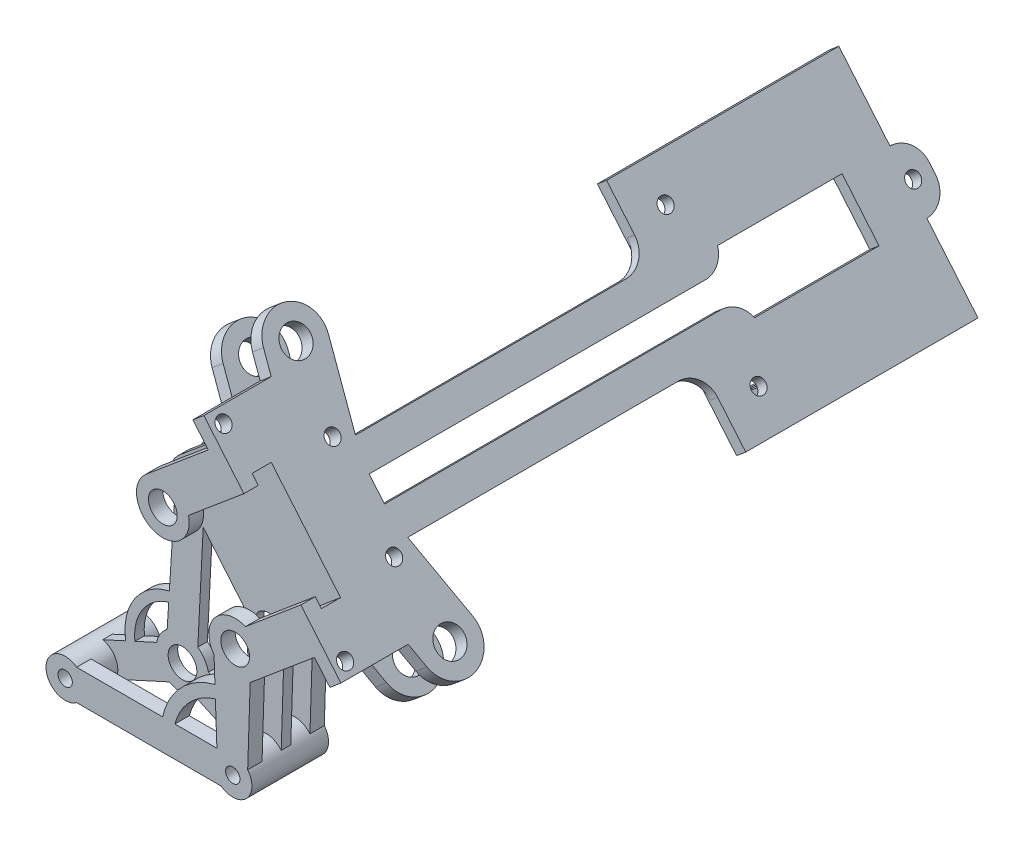
from build123d import *

# Parameters (mm, degrees)
SKETCH2_R             = 4
SKETCH2_R_2           = 1.5
BOSS_EXTRUDE1_DEPTH   = 7
BOSS_EXTRUDE1_2_DEPTH = 7
SKETCH3_R             = 1.5
SKETCH3_R_2           = 3
SKETCH3_R_3           = 4
BOSS_EXTRUDE2_DEPTH   = 2
SKETCH6_R             = 1.5
SKETCH6_R_2           = 3
SKETCH6_R_3           = 5.5
BOSS_EXTRUDE4_DEPTH   = 3
SKETCH7_R             = 4
SKETCH7_R_2           = 1.5
BOSS_EXTRUDE5_DEPTH   = 4
SKETCH8_R             = 3
BOSS_EXTRUDE6_DEPTH   = 3
SKETCH9_R             = 3
SKETCH9_R_2           = 1.5
BOSS_EXTRUDE8_DEPTH   = 3
BOSS_EXTRUDE9_DEPTH   = 75
SKETCH11_R            = 1.5
BOSS_EXTRUDE10_DEPTH  = 3
SKETCH12_R            = 1.5
BOSS_EXTRUDE11_DEPTH  = 2.5
FILLET1_R             = 5
SKETCH13_R            = 3
BOSS_EXTRUDE12_DEPTH  = 3
BOSS_EXTRUDE13_DEPTH  = 8


with BuildPart() as part:
    # Sketch2 → Boss-Extrude1 (new body)
    with BuildSketch(Plane.XY):
        with Locations((-17.5, 0)):
            Circle(SKETCH2_R)
        with Locations((-17.5, 0)):
            Circle(SKETCH2_R_2, mode=Mode.SUBTRACT)
    extrude(amount=BOSS_EXTRUDE1_DEPTH)



with BuildPart() as body_2:
    # Sketch2 → Boss-Extrude1 2 (new body)
    with BuildSketch(Plane.XY):
        with Locations((17.5, 0)):
            Circle(SKETCH2_R)
        with Locations((17.5, 0)):
            Circle(SKETCH2_R_2, mode=Mode.SUBTRACT)
    extrude(amount=BOSS_EXTRUDE1_2_DEPTH)


with BuildPart() as part_1:
    add(part.part)

    add(body_2.part)  # Boss-Extrude2 merges body 2
    # Sketch3 → Boss-Extrude2 (add)
    # profile 1 of 3: a face of its own
    with BuildSketch(Plane.XY.offset(7)):
        with BuildLine():
            ThreePointArc((21.137225392, 18.586588577), (21.340800886, 18.734844666), (21.537376267, 18.89226439))
            Line((21.537376267, 18.89226439), (36.858265129, 31.748016584))
            Line((36.858265129, 31.748016584), (14.682092595, 58.176549872))
            Line((14.682092595, 58.176549872), (-0.638796268, 45.320797678))
            ThreePointArc((-0.638796268, 45.320797678), (-2.559422624, 41.802189843), (-1.581734555, 37.914577114))
            Line((-1.581734555, 37.914577114), (-2.741425754, 19.682661719))
            ThreePointArc((-2.741425754, 19.682661719), (-9.966399712, 14.683627516), (-11.848927209, 6.101863019))
            Line((-11.848927209, 6.101863019), (-16.647692491, 3.908141747))
            ThreePointArc((-16.647692491, 3.908141747), (-21.137897902, -1.663039041), (-13.986830026, -1.912494897))
            Line((-13.986830026, -1.912494897), (-2.737878966, 3.22988273))
            ThreePointArc((-2.737878966, 3.22988273), (0, 2.5), (2.737878966, 3.22988273))
            Line((2.737878966, 3.22988273), (13.986830026, -1.912494897))
            ThreePointArc((13.986830026, -1.912494897), (15.278093559, 3.326128645), (20.611912853, 2.513165015))
            Line((20.611912853, 2.513165015), (21.137225392, 18.586588577))
        make_face()
        with Locations((-17.5, 0)):
            Circle(SKETCH3_R, mode=Mode.SUBTRACT)
        with Locations((0, 8)):
            Circle(SKETCH3_R_2, mode=Mode.SUBTRACT)
        with BuildLine():
            Line((-2.875316927, 17.577711238), (-3.2, 12.473253849))
            ThreePointArc((-3.2, 12.473253849), (-4.627457874, 10.972647578), (-5.398741432, 9.050519374))
            Line((-5.398741432, 9.050519374), (-9.94695196, 6.971337418))
            ThreePointArc((-9.94695196, 6.971337418), (-8.32024256, 13.547392517), (-2.875316927, 17.577711238))
        make_face(mode=Mode.SUBTRACT)
        with BuildLine():
            Line((4.326299478, 34.736455505), (12.740806612, 24.708436398))
            ThreePointArc((12.740806612, 24.708436398), (12.568665188, 22.252051039), (13.485617545, 19.966737039))
            Line((13.485617545, 19.966737039), (14.116251643, 5.065371849))
            Line((14.116251643, 5.065371849), (5.398741432, 9.050519374))
            ThreePointArc((5.398741432, 9.050519374), (4.627457874, 10.972647578), (3.2, 12.473253849))
            Line((3.2, 12.473253849), (4.326299478, 34.736455505))
        make_face(mode=Mode.SUBTRACT)
        with Locations((18.002044413, 23.105508828)):
            Circle(SKETCH3_R_2, mode=Mode.SUBTRACT)
        with Locations((2.896535586, 41.107553241)):
            Circle(SKETCH3_R_2, mode=Mode.SUBTRACT)
        with BuildLine():
            Line((29.937361698, 33.773132804), (21.876448824, 27.009223784))
            ThreePointArc((21.876448824, 27.009223784), (19.785398403, 28.308358869), (17.337073271, 28.565162056))
            Line((17.337073271, 28.565162056), (8.157773387, 39.50462567))
            ThreePointArc((8.157773387, 39.50462567), (8.330018814, 41.960348648), (7.413727606, 44.245223754))
            Line((7.413727606, 44.245223754), (15.47464048, 51.009132774))
            Line((15.47464048, 51.009132774), (29.937361698, 33.773132804))
        make_face(mode=Mode.SUBTRACT)
    # profile 2 of 3: a face of its own
    with BuildSketch(Plane.XY.offset(7)):
        with Locations(Location((17.5, 0, 0), (0, 0, 208.562931034))):
            Circle(SKETCH3_R_3)
        with Locations((17.5, 0)):
            Circle(SKETCH3_R, mode=Mode.SUBTRACT)
    # profile 3 of 3: a face of its own
    with BuildSketch(Plane.XY.offset(7)):
        with BuildLine():
            ThreePointArc((21.876448824, 27.009223784), (19.785398403, 28.308358869), (17.337073271, 28.565162056))
            Line((17.337073271, 28.565162056), (8.157773387, 39.50462567))
            ThreePointArc((8.157773387, 39.50462567), (8.330018814, 41.960348648), (7.413727606, 44.245223754))
            Line((7.413727606, 44.245223754), (15.47464048, 51.009132774))
            Line((15.47464048, 51.009132774), (29.937361698, 33.773132804))
            Line((29.937361698, 33.773132804), (21.876448824, 27.009223784))
        make_face()
    extrude(amount=BOSS_EXTRUDE2_DEPTH)



with BuildPart() as body_2_2:
    # Sketch6 → Boss-Extrude4 (new body)
    # profile 1 of 4: a face of its own
    with BuildSketch(Plane.XY.offset(13)):
        with BuildLine():
            ThreePointArc((21.137225392, 18.586588577), (21.340800886, 18.734844666), (21.537376267, 18.89226439))
            ThreePointArc((21.537376267, 18.89226439), (23.441378188, 23.920154816), (20.147911401, 28.169623249))
            ThreePointArc((20.147911401, 28.169623249), (13.678640116, 26.505240477), (13.586803354, 19.825928613))
            Line((13.586803354, 19.825928613), (13.776743375, 14.530566407))
            ThreePointArc((13.776743375, 14.530566407), (6.704969503, 10.414764355), (2.845307919, 3.2))
            Line((2.845307919, 3.2), (-15.1, 3.2))
            ThreePointArc((-15.1, 3.2), (-21.5, 0), (-15.1, -3.2))
            Line((-15.1, -3.2), (15.1, -3.2))
            ThreePointArc((15.1, -3.2), (20.378674799, -2.777270495), (20.611912853, 2.513165015))
            Line((20.611912853, 2.513165015), (21.137225392, 18.586588577))
        make_face()
        with Locations((-17.5, 0)):
            Circle(SKETCH6_R, mode=Mode.SUBTRACT)
        with Locations((17.5, 0)):
            Circle(SKETCH6_R, mode=Mode.SUBTRACT)
        with BuildLine():
            Line((13.868911961, 11.960986567), (14.183160904, 3.2))
            Line((14.183160904, 3.2), (5.416540231, 3.2))
            ThreePointArc((5.416540231, 3.2), (8.504141252, 8.678970295), (13.868911961, 11.960986567))
        make_face(mode=Mode.SUBTRACT)
        with Locations((18.002044413, 23.105508828)):
            Circle(SKETCH6_R_2, mode=Mode.SUBTRACT)
    # profile 2 of 4: a face of its own
    with BuildSketch(Plane.XY.offset(13)):
        with BuildLine():
            ThreePointArc((20.147911401, 28.169623249), (23.441378188, 23.920154816), (21.537376267, 18.89226439))
            Line((21.537376267, 18.89226439), (36.858265129, 31.748016584))
            Line((36.858265129, 31.748016584), (31.715964251, 37.876372129))
            Line((31.715964251, 37.876372129), (20.147911401, 28.169623249))
        make_face()
    # profile 3 of 4: a face of its own
    with BuildSketch(Plane.XY.offset(13)):
        with BuildLine():
            Line((14.682092595, 58.176549872), (-0.638796268, 45.320797678))
            ThreePointArc((-0.638796268, 45.320797678), (4.643335668, 46.322789522), (8.256340622, 42.341445447))
            Line((8.256340622, 42.341445447), (19.824393472, 52.048194327))
            Line((19.824393472, 52.048194327), (14.682092595, 58.176549872))
        make_face()
    # profile 4 of 4: a face of its own
    with BuildSketch(Plane.XY.offset(13)):
        with Locations((2.896535586, 41.107553241)):
            Circle(SKETCH6_R_3)
        with Locations((2.896535586, 41.107553241)):
            Circle(SKETCH6_R_2, mode=Mode.SUBTRACT)
    extrude(amount=BOSS_EXTRUDE4_DEPTH)


with BuildPart() as part_2:
    add(part_1.part)

    add(body_2_2.part)  # Boss-Extrude5 merges body 2 2
    # Sketch7 → Boss-Extrude5 (add)
    # profile 1 of 4: a face of its own
    with BuildSketch(Plane.XY.offset(9)):
        with Locations(Location((-17.5, 0, 0), (0, 0, 306.869897646))):
            Circle(SKETCH7_R)
        with Locations((-17.5, 0)):
            Circle(SKETCH7_R_2, mode=Mode.SUBTRACT)
    # profile 2 of 4: a face of its own
    with BuildSketch(Plane.XY.offset(9)):
        with Locations(Location((17.5, 0, 0), (0, 0, 233.130102354))):
            Circle(SKETCH7_R)
        with Locations((17.5, 0)):
            Circle(SKETCH7_R_2, mode=Mode.SUBTRACT)
    # profile 3 of 4: a face of its own
    with BuildSketch(Plane.XY.offset(9)):
        Polygon((28.405272812, 32.487557585), (33.001539471, 36.344283243), (36.858265129, 31.748016584), (32.26199847, 27.891290926), align=None)
    # profile 4 of 4: a face of its own
    with BuildSketch(Plane.XY.offset(9)):
        Polygon((14.682092595, 58.176549872), (10.085825936, 54.319824214), (13.942551594, 49.723557555), (18.538818253, 53.580283213), align=None)
    extrude(amount=BOSS_EXTRUDE5_DEPTH)

    # Sketch8 → Boss-Extrude6 (add)
    with BuildSketch(Plane.XY):
        with BuildLine():
            Line((36.858265129, 31.748016584), (14.682092595, 58.176549872))
            Line((14.682092595, 58.176549872), (-0.638796268, 45.320797678))
            ThreePointArc((-0.638796268, 45.320797678), (-2.148360842, 38.916886668), (3.561506728, 35.647900012))
            Line((3.561506728, 35.647900012), (12.740806612, 24.708436398))
            ThreePointArc((12.740806612, 24.708436398), (12.568665188, 22.252051039), (13.485617545, 19.966737039))
            Line((13.485617545, 19.966737039), (14.232949583, 2.307895486))
            ThreePointArc((14.232949583, 2.307895486), (17.371350045, 3.997930613), (20.611912853, 2.513165015))
            Line((20.611912853, 2.513165015), (21.137225392, 18.586588577))
            Line((21.137225392, 18.586588577), (21.899176931, 19.22448343))
            Line((21.899176931, 19.22448343), (36.858265129, 31.748016584))
        make_face()
        with Locations((18.002044413, 23.105508828)):
            Circle(SKETCH8_R, mode=Mode.SUBTRACT)
        with Locations((2.896535586, 41.107553241)):
            Circle(SKETCH8_R, mode=Mode.SUBTRACT)
        with BuildLine():
            Line((14.145318755, 27.701775486), (6.753261244, 36.511286582))
            ThreePointArc((6.753261244, 36.511286582), (8.876053194, 41.602900762), (5.94436213, 46.275797949))
            Line((5.94436213, 46.275797949), (13.101627013, 52.281456272))
            Line((13.101627013, 52.281456272), (30.778286279, 31.215234087))
            Line((30.778286279, 31.215234087), (23.621021396, 25.209575763))
            ThreePointArc((23.621021396, 25.209575763), (19.528198828, 28.908167934), (14.145318755, 27.701775486))
        make_face(mode=Mode.SUBTRACT)
    extrude(amount=BOSS_EXTRUDE6_DEPTH)

    # Sketch9 → Boss-Extrude8 (add)
    with BuildSketch(Plane(origin=(37.262164288, 31.266668311, 0), x_dir=(0, 0, -1), z_dir=(0.7660444431189815, 0.6427876096865354, 0))):
        with BuildLine():
            Line((-7, 35.128355545), (-7, 0.628355545))
            Line((-7, 0.628355545), (-16, 0.628355545))
            Line((-16, 0.628355545), (-16, -4.371644455))
            Line((-16, -4.371644455), (-1.943181185, -4.371644455))
            Line((-1.943181185, -4.371644455), (-0.797349841, -8.667844579))
            ThreePointArc((-0.797349841, -8.667844579), (6.546200124, -12.918994296), (10.797349841, -5.575444331))
            Line((10.797349841, -5.575444331), (5.813354305, 13.111635877))
            Line((5.813354305, 13.111635877), (5.813354305, 22.645075213))
            Line((5.813354305, 22.645075213), (10.797349841, 41.332155421))
            ThreePointArc((10.797349841, 41.332155421), (6.546200124, 48.675705386), (-0.797349841, 44.424555669))
            Line((-0.797349841, 44.424555669), (-1.943181185, 40.128355545))
            Line((-1.943181185, 40.128355545), (-16, 40.128355545))
            Line((-16, 40.128355545), (-16, 35.128355545))
            Line((-16, 35.128355545), (-7, 35.128355545))
        make_face()
        with Locations(Location((5, 42.878355545, 0), (0, 0, 90))):
            Circle(SKETCH9_R, mode=Mode.SUBTRACT)
        with Locations(Location((-13.5, 37.628355545, 0), (0, 0, 90))):
            Circle(SKETCH9_R_2, mode=Mode.SUBTRACT)
        with Locations(Location((-13.5, -1.871644455, 0), (0, 0, 270))):
            Circle(SKETCH9_R_2, mode=Mode.SUBTRACT)
        with Locations(Location((5, -7.121644455, 0), (0, 0, 270))):
            Circle(SKETCH9_R, mode=Mode.SUBTRACT)
        with Locations(Location((3, 27.878355545, 0), (0, 0, 90))):
            Circle(SKETCH9_R_2, mode=Mode.SUBTRACT)
        with Locations(Location((3, 7.878355545, 0), (0, 0, 270))):
            Circle(SKETCH9_R_2, mode=Mode.SUBTRACT)
    extrude(amount=-BOSS_EXTRUDE8_DEPTH)

    # Sketch10 → Boss-Extrude9 (add)
    with BuildSketch(Plane(origin=(0, 0, -5.813354305), x_dir=(-1, 0, 0), z_dir=(0, 0, -1))):
        Polygon((-24.163209838, 46.877394336), (-22.631120951, 45.591819116), (-18.774395293, 50.188085775), (-20.30648418, 51.473660995), align=None)
        Polygon((-29.701784658, 37.165330242), (-31.233873544, 38.450905462), (-27.377147886, 43.04717212), (-25.845059, 41.761596901), align=None)
    extrude(amount=BOSS_EXTRUDE9_DEPTH)



with BuildPart() as body_2_3:
    # Sketch11 → Boss-Extrude10 (new body)
    # profile 1 of 2: a face of its own
    with BuildSketch(Plane(origin=(-1.464498715, 1.745321605, 0), x_dir=(-0.7660444431189826, -0.642787609686534, 0), z_dir=(0.642787609686534, -0.7660444431189826, 0))):
        Polygon((-45.642300877, 95.813354305), (-48.642300877, 95.813354305), (-48.642300877, 78.813354305), (-35.642300877, 78.813354305), (-35.642300877, 84.563354305), (-45.642300877, 84.563354305), align=None)
        with Locations((-39.642300877, 81.813354305)):
            Circle(SKETCH11_R, mode=Mode.SUBTRACT)
    # profile 2 of 2: a face of its own
    with BuildSketch(Plane(origin=(-1.464498715, 1.745321605, 0), x_dir=(-0.7660444431189826, -0.642787609686534, 0), z_dir=(0.642787609686534, -0.7660444431189826, 0))):
        Polygon((-35.642300877, 112.813354305), (-48.642300877, 112.813354305), (-48.642300877, 95.813354305), (-45.642300877, 95.813354305), (-45.642300877, 107.063354305), (-35.642300877, 107.063354305), align=None)
        with Locations((-39.642300877, 109.813354305)):
            Circle(SKETCH11_R, mode=Mode.SUBTRACT)
    extrude(amount=BOSS_EXTRUDE10_DEPTH)


with BuildPart() as part_3:
    add(part_2.part)

    add(body_2_3.part)  # Boss-Extrude11 merges body 2 3
    # Sketch12 → Boss-Extrude11 (add)
    with BuildSketch(Plane(origin=(37.262164288, 31.266668311, 0), x_dir=(0, 0, -1), z_dir=(0.7660444431189815, 0.6427876096865354, 0))):
        Polygon((116.813354305, 23.878355545), (121.813354305, 23.878355545), (121.813354305, 11.878355545), (116.813354305, 11.878355545), (116.813354305, -4.721644455), (68.313354305, -4.721644455), (68.313354305, 11.878355545), (106.813354305, 11.878355545), (106.813354305, 23.878355545), (68.313354305, 23.878355545), (68.313354305, 40.478355545), (116.813354305, 40.478355545), align=None)
        with Locations(Location((117.813354305, 17.878355545, 0), (0, 0, 90))):
            Circle(SKETCH12_R, mode=Mode.SUBTRACT)
        with Locations(Location((75.813354305, 32.978355545, 0), (0, 0, 90))):
            Circle(SKETCH12_R, mode=Mode.SUBTRACT)
        with Locations(Location((75.813354305, 2.778355545, 0), (0, 0, 270))):
            Circle(SKETCH12_R, mode=Mode.SUBTRACT)
    extrude(amount=-BOSS_EXTRUDE11_DEPTH)

    # Fillet1
    # the kernel refuses this fillet: 5 mm, written as the material it adds along each edge
    with BuildSketch(Plane(origin=(29.701784658, 37.165330242, -68.313354305), x_dir=(0, 0, 1), z_dir=(0.7660444431189839, 0.6427876096865325, 0))) as fillet1_piece_1:
        with BuildLine():
            CenterArc((FILLET1_R, FILLET1_R), FILLET1_R, 180, 90)
            Line((0, FILLET1_R), (0, 0))
            Line((0, 0), (FILLET1_R, 0))
        make_face()
    extrude(amount=2)
    with BuildSketch(Plane(origin=(18.774395293, 50.188085775, -68.313354305), x_dir=(0, 0, 1), z_dir=(0.7660444431189821, 0.6427876096865345, 0))) as fillet1_piece_2:
        with BuildLine():
            CenterArc((FILLET1_R, -FILLET1_R), FILLET1_R, 90, 90)
            Line((0, -FILLET1_R), (0, 0))
            Line((0, 0), (FILLET1_R, 0))
        make_face()
    extrude(amount=2)
    # the kernel refuses this fillet: 5 mm, written as the material it takes off along each edge
    with BuildSketch(Plane(origin=(39.202460059, 48.40086169, -121.813354305), x_dir=(0, 0, 1), z_dir=(-0.7660444431189815, -0.6427876096865354, 0)), Plane(origin=(31.489008743, 57.593395008, -121.813354305), x_dir=(0.6427876096865354, -0.7660444431189815, 0), z_dir=(-0.7660444431189815, -0.6427876096865354, 0))) as fillet1_2_piece_1:
        with BuildLine():
            CenterArc((FILLET1_R, FILLET1_R), FILLET1_R, 180, 90)
            Line((0, FILLET1_R), (0, 0))
            Line((0, 0), (FILLET1_R, 0))
        make_face()
    extrude(amount=27.5, mode=Mode.SUBTRACT)
    with BuildSketch(Plane(origin=(33.297707642, 54.542148074, -80.813354305), x_dir=(0, 0, 1), z_dir=(-0.7660444431189815, -0.6427876096865354, 0))) as fillet1_2_piece_2:
        with BuildLine():
            CenterArc((4.769696007, 5), FILLET1_R, 197.457603124, 72.542396876)
            Line((0, 3.5), (0, 0))
            Line((0, 0), (4.769696007, 0))
        make_face()
    extrude(amount=25.848480035, mode=Mode.SUBTRACT)
    with BuildSketch(Plane(origin=(36.51164569, 50.711925859, -80.813354305), x_dir=(0, 0, 1), z_dir=(-0.7660444431189831, -0.6427876096865333, 0))) as fillet1_2_piece_3:
        with BuildLine():
            CenterArc((4.769696007, -5), FILLET1_R, 90, 72.542396876)
            Line((0, -3.5), (0, 0))
            Line((0, 0), (4.769696007, 0))
        make_face()
    extrude(amount=25.848480035, mode=Mode.SUBTRACT)

    # Sketch13 → Boss-Extrude12 (add)
    # profile 1 of 2: a face of its own
    with BuildSketch(Plane(origin=(28.835675413, 24.196004604, 0), x_dir=(0, 0, 1), z_dir=(-0.7660444431189815, -0.6427876096865355, 0))):
        with BuildLine():
            Line((0.797349841, 44.424555669), (3, 36.165900561))
            Line((3, 36.165900561), (3, 35.128355545))
            Line((3, 35.128355545), (0, 35.128355545))
            Line((0, 35.128355545), (0, 31.628355545))
            Line((0, 31.628355545), (-8.209267876, 31.628355545))
            Line((-8.209267876, 31.628355545), (-10.797349841, 41.332155421))
            ThreePointArc((-10.797349841, 41.332155421), (-6.546200124, 48.675705386), (0.797349841, 44.424555669))
        make_face()
        with Locations(Location((-5, 42.878355545, 0), (0, 0, 90))):
            Circle(SKETCH13_R, mode=Mode.SUBTRACT)
    # profile 2 of 2: a face of its own
    with BuildSketch(Plane(origin=(28.835675413, 24.196004604, 0), x_dir=(0, 0, 1), z_dir=(-0.7660444431189815, -0.6427876096865355, 0))):
        with BuildLine():
            Line((3, 0.628355545), (3, -0.409189471))
            Line((3, -0.409189471), (0.797349841, -8.667844579))
            ThreePointArc((0.797349841, -8.667844579), (-6.546200124, -12.918994296), (-10.797349841, -5.575444331))
            Line((-10.797349841, -5.575444331), (-8.209267876, 4.128355545))
            Line((-8.209267876, 4.128355545), (0, 4.128355545))
            Line((0, 4.128355545), (0, 0.628355545))
            Line((0, 0.628355545), (3, 0.628355545))
        make_face()
        with Locations(Location((-5, -7.121644455, 0), (0, 0, 270))):
            Circle(SKETCH13_R, mode=Mode.SUBTRACT)
    extrude(amount=BOSS_EXTRUDE12_DEPTH)

    # Sketch14 → Boss-Extrude13 (add)
    with BuildSketch(Plane(origin=(28.835675413, 24.196004604, 0), x_dir=(0, 0, 1), z_dir=(-0.7660444431189815, -0.6427876096865355, 0))):
        Polygon((0, 31.628355545), (-8.209267876, 31.628355545), (-9.009392156, 34.628355545), (0, 34.628355545), align=None)
        Polygon((-9.009392156, 1.128355545), (0, 1.128355545), (0, 4.128355545), (-8.209267876, 4.128355545), align=None)
    extrude(amount=-BOSS_EXTRUDE13_DEPTH)


solid = part_3.part
